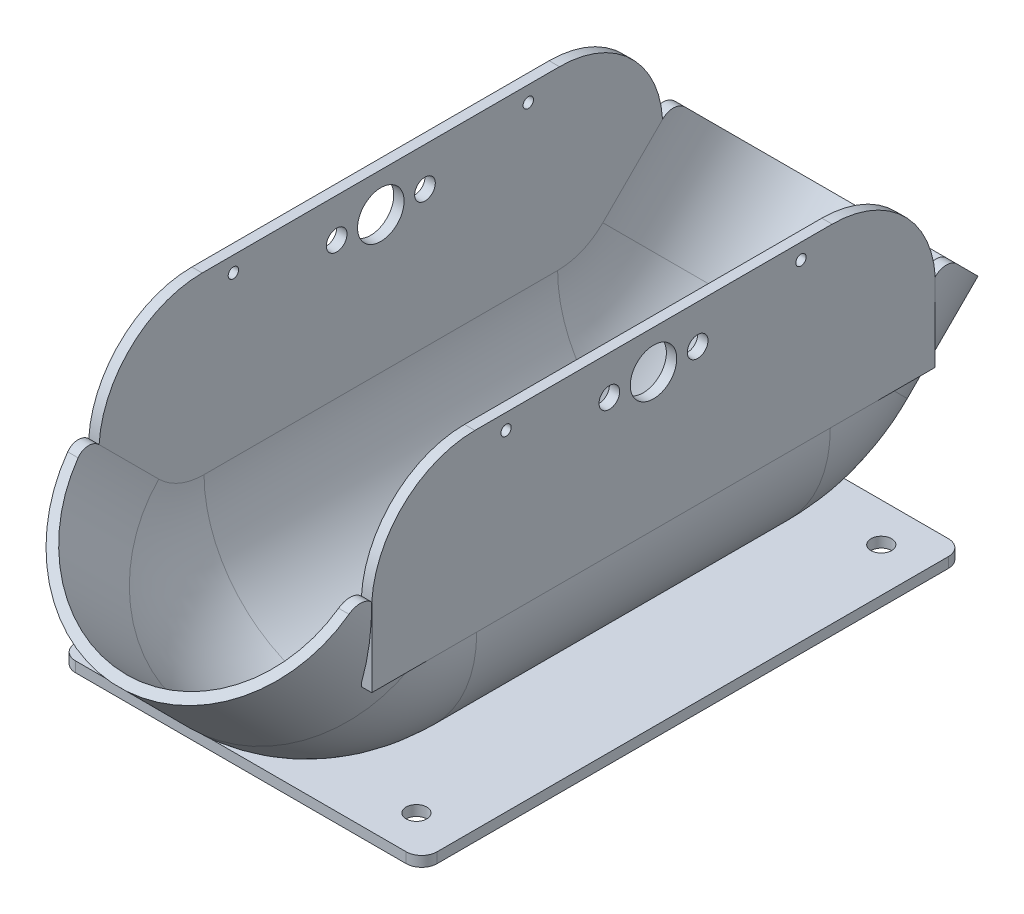
from build123d import *

# Parameters (mm, degrees)
SKETCH6_W           = 70
SKETCH6_H           = 105
BOSS_EXTRUDE1_DEPTH = 2
CUT_EXTRUDE1_START  = -25.4
SKETCH4_R           = 2
CUT_EXTRUDE1_DEPTH  = 5
FILLET1_R           = 3
FILLET2_R           = 3
BOSS_EXTRUDE2_REACH = 105.819
SKETCH9_W           = 2
SKETCH9_H           = 109.10689276
SKETCH10_R          = 2
SKETCH10_R_2        = 4.5
CUT_EXTRUDE2_DEPTH  = 105.083069428
SKETCH11_R          = 1
CUT_EXTRUDE4_DEPTH  = 105.083069428
FILLET4_R           = 20


with BuildPart() as part:
    # Sweep2: sweep along a path in Sketch3
    with BuildLine(Plane(origin=(0, 0, 0), x_dir=(0, 0, -1), z_dir=(1, 0, 0))) as sweep2_path:
        Line((76.2, -2.212849708), (62.515728753, -15.897120955))
        ThreePointArc((62.515728753, -15.897120955), (49.5387948, -24.568031008), (34.231457505, -27.612849708))
        Line((34.231457505, -27.612849708), (-34.231457505, -27.612849708))
        ThreePointArc((-34.231457505, -27.612849708), (-49.5387948, -24.568031008), (-62.515728753, -15.897120955))
        Line((-62.515728753, -15.897120955), (-76.2, -2.212849708))
    # Sketch1 → Sweep2 (sweep)
    with BuildSketch(Plane.XY):
        with BuildLine():
            Line((-25.4, 0), (-27.4, 0))
            ThreePointArc((-27.4, 0), (0, -27.4), (27.4, 0))
            Line((27.4, 0), (25.4, 0))
            ThreePointArc((25.4, 0), (0, -25.4), (-25.4, 0))
        make_face()
    sweep(path=sweep2_path.line)

    # Sketch6 → Boss-Extrude1 (add)
    with BuildSketch(Plane(origin=(0, -27.4, 0), x_dir=(-1, 0, 0), z_dir=(0, -1, 0))):
        Rectangle(SKETCH6_W, SKETCH6_H)
    extrude(amount=-BOSS_EXTRUDE1_DEPTH)

    # Sketch4 → Cut-Extrude1 (cut)
    with BuildSketch(Plane(origin=(0, 0, 0), x_dir=(1, 0, 0), z_dir=(0, 1, 0)).offset(CUT_EXTRUDE1_START)):
        with Locations(Location((-26.5, 45, 0), (0, 0, 90))):
            Circle(SKETCH4_R)
        with Locations(Location((26.5, 45, 0), (0, 0, 90))):
            Circle(SKETCH4_R)
        with Locations(Location((-26.5, -45, 0), (0, 0, 90))):
            Circle(SKETCH4_R)
        with Locations(Location((26.5, -45, 0), (0, 0, 90))):
            Circle(SKETCH4_R)
    extrude(amount=-CUT_EXTRUDE1_DEPTH, mode=Mode.SUBTRACT)

    # Fillet1
    fillet1_edges = [part.edges().sort_by_distance(p)[0] for p in [
        (26.4, 17.312383569, 56.674766724),
        (26.4, 17.312383569, -56.674766724),
        (-26.4, 17.312383569, -56.674766724),
        (-26.4, 17.312383569, 56.674766724),
    ]]
    fillet(fillet1_edges, radius=FILLET1_R)

    # Fillet2
    fillet2_edges = [part.edges().sort_by_distance(p)[0] for p in [
        (35, -26.4, 52.5),
        (35, -26.4, -52.5),
        (-35, -26.4, -52.5),
        (-35, -26.4, 52.5),
    ]]
    fillet(fillet2_edges, radius=FILLET2_R)

    # Boss-Extrude2: up to this face of the body (flat: up to its plane)
    boss_extrude2_end = Plane(part.part.faces().sort_by_distance((-26.4, 0, 0))[0])
    # Sketch9 → Boss-Extrude2 (add, up to the picked face)
    with BuildSketch(Plane(origin=(0, 34, 0), x_dir=(1, 0, 0), z_dir=(0, 1, 0)), mode=Mode.PRIVATE) as boss_extrude2_sk1:
        with Locations((-26.4, 0)):
            Rectangle(SKETCH9_W, SKETCH9_H)
    boss_extrude2_tool1 = split(extrude(boss_extrude2_sk1.sketch, amount=-BOSS_EXTRUDE2_REACH, mode=Mode.PRIVATE), bisect_by=boss_extrude2_end, keep=Keep.BOTH, mode=Mode.PRIVATE)
    # Sketch9 → Boss-Extrude2 (add, up to the picked face)
    with BuildSketch(Plane(origin=(0, 34, 0), x_dir=(1, 0, 0), z_dir=(0, 1, 0)), mode=Mode.PRIVATE) as boss_extrude2_sk2:
        with Locations((26.4, 0)):
            Rectangle(SKETCH9_W, SKETCH9_H)
    boss_extrude2_tool2 = split(extrude(boss_extrude2_sk2.sketch, amount=-BOSS_EXTRUDE2_REACH, mode=Mode.PRIVATE), bisect_by=boss_extrude2_end, keep=Keep.BOTH, mode=Mode.PRIVATE)
    add(boss_extrude2_tool1.solids().sort_by(Axis((-26.4, 34, 0), (0, -1, 0)))[0])
    add(boss_extrude2_tool2.solids().sort_by(Axis((26.4, 34, 0), (0, -1, 0)))[0])

    # Sketch10 → Cut-Extrude2 (cut, through all)
    with BuildSketch(Plane.ZY.offset(27.4)):
        with Locations((-8.55, 26.5)):
            Circle(SKETCH10_R)
        with Locations((8.55, 26.5)):
            Circle(SKETCH10_R)
        with Locations((0, 26.5)):
            Circle(SKETCH10_R_2)
    extrude(amount=-CUT_EXTRUDE2_DEPTH, mode=Mode.SUBTRACT)

    # Sketch11 → Cut-Extrude4 (cut, through all)
    with BuildSketch(Plane.ZY.offset(27.4)):
        with Locations((-28.55, 31)):
            Circle(SKETCH11_R)
        with Locations((28.55, 31)):
            Circle(SKETCH11_R)
    extrude(amount=-CUT_EXTRUDE4_DEPTH, mode=Mode.SUBTRACT)

    # Fillet4
    # the kernel refuses this fillet: 20 mm, written as the material it takes off along each edge
    with BuildSketch(Plane(origin=(77.311256771, 34, 54.55344638), x_dir=(0, 0, -1), z_dir=(-1, 0, 0)), Plane(origin=(24.511256771, 34, 54.55344638), x_dir=(0, 0, -1), z_dir=(-1, 0, 0)), Plane(origin=(-24.511256771, 34, -54.55344638), x_dir=(0, 0, 1), z_dir=(1, 0, 0)), Plane(origin=(-77.311256771, 34, -54.55344638), x_dir=(0, 0, 1), z_dir=(1, 0, 0))) as fillet4_piece_1:
        with BuildLine():
            CenterArc((19.964502708, 20), FILLET4_R, 183.414164929, 86.585835071)
            Line((0, 18.808936775), (0, 0))
            Line((0, 0), (19.964502708, 0))
        make_face()
    extrude(amount=101.822513542, mode=Mode.SUBTRACT)


solid = part.part
